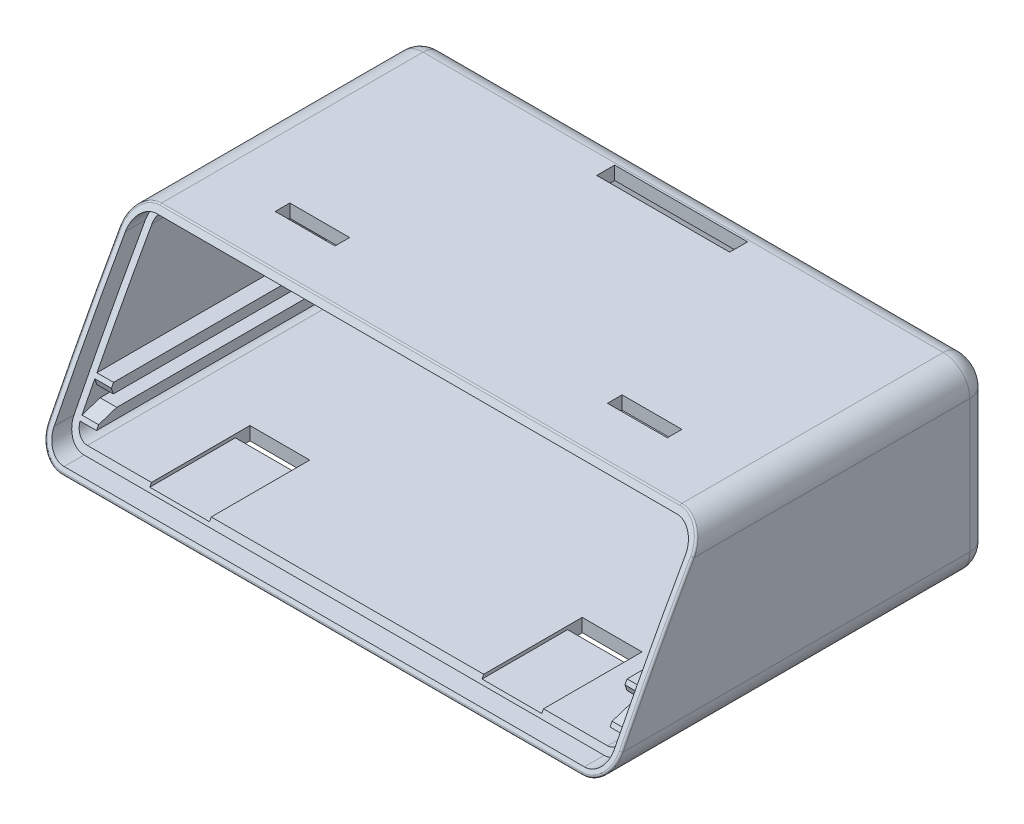
from build123d import *

# Parameters (mm, degrees)
SKETCH1_W                = 86.28
SKETCH1_H                = 57.5
BOSS_EXTRUDE1_DEPTH      = 28
FILLET1_R                = 4
SHELL1_T                 = -2
CUT_EXTRUDE1_DEPTH       = 96.156717577
SKETCH3_W                = 14.3
SKETCH3_H                = 16.7
SKETCH3_W_2              = 11.05
SKETCH3_H_2              = 14.049996967
CUT_EXTRUDE2_DEPTH       = 2
FILLET2_R                = 3
CUT_EXTRUDE3_REACH       = 157.666
CUT_EXTRUDE3_END_RADIUS  = 475
CUT_EXTRUDE3_START       = 80
FILLET3_R                = 0.3
BOSS_EXTRUDE2_REACH      = 77.532
BOSS_EXTRUDE2_END_RADIUS = 475
SKETCH5_W                = 2.5
SKETCH5_H                = 1.5
SKETCH6_W                = 9
SKETCH6_H                = 2.2
CUT_EXTRUDE4_DEPTH       = 2
SKETCH9_W                = 9
SKETCH9_H                = 2.2
CUT_EXTRUDE7_DEPTH       = 2
SKETCH7_W                = 20
SKETCH7_H                = 2.4
CUT_EXTRUDE5_DEPTH       = 2
SKETCH8_W                = 9
SKETCH8_H                = 0.5
CUT_EXTRUDE6_DEPTH       = 63.142368914
SKETCH10_W               = 9
SKETCH10_H               = 0.5
CUT_EXTRUDE8_DEPTH       = 66.69805183
SKETCH11_W               = 2.84
SKETCH11_H               = 2
SKETCH11_W_2             = 33.99
SKETCH11_W_3             = 20.1
BOSS_EXTRUDE3_DEPTH      = 0.5
CHAMFER1_SIZE2           = 2.284662113
CHAMFER1_SIZE            = 1
CHAMFER1_EDGE_2_SIZE2    = 0.742484525
CHAMFER1_EDGE_2_SIZE     = 1
CHAMFER1_EDGE_3_SIZE2    = 0.742484525
CHAMFER1_EDGE_3_SIZE     = 1
CHAMFER1_EDGE_4_SIZE2    = 2.284662113
CHAMFER1_EDGE_4_SIZE     = 1
SKETCH12_W               = 20
SKETCH12_H               = 2
CUT_EXTRUDE9_DEPTH       = 0.3


with BuildPart() as part:
    # Sketch1 → Boss-Extrude1 (new body)
    with BuildSketch(Plane(origin=(0, 0, 0), x_dir=(1, 0, 0), z_dir=(0, 1, 0))):
        Rectangle(SKETCH1_W, SKETCH1_H)
    extrude(amount=BOSS_EXTRUDE1_DEPTH)

    # Fillet1
    fillet1_edges = [part.edges().sort_by_distance(p)[0] for p in [
        (-43.14, 28, 0),
        (43.14, 28, 0),
        (-43.14, 0, 0),
        (43.14, 0, 0),
    ]]
    fillet(fillet1_edges, radius=FILLET1_R)

    # Shell1
    shell1_openings = [part.faces().sort_by_distance(p)[0] for p in [
        (0, 14, 28.75),
    ]]
    offset(amount=SHELL1_T, openings=shell1_openings, kind=Kind.INTERSECTION)

    # Sketch2 → Cut-Extrude1 (cut, through all)
    with BuildSketch(Plane.ZY.offset(43.14)):
        with BuildLine():
            Line((13.75, 28), (28.75, 28))
            Line((28.75, 28), (28.75, 0))
            ThreePointArc((28.75, 0), (21.484121584, 14.125422277), (13.75, 28))
        make_face()
    extrude(amount=-CUT_EXTRUDE1_DEPTH, mode=Mode.SUBTRACT)

    # Sketch3 → Cut-Extrude2 (cut)
    with BuildSketch(Plane(origin=(0, 0, -28.75), x_dir=(-1, 0, 0), z_dir=(0, 0, -1))):
        with Locations((0, 10.35)):
            Rectangle(SKETCH3_W, SKETCH3_H)
        with Locations((32.775, 10.175001517)):
            Rectangle(SKETCH3_W_2, SKETCH3_H_2)
    extrude(amount=-CUT_EXTRUDE2_DEPTH, mode=Mode.SUBTRACT)

    # Fillet2
    # the kernel refuses this fillet: 3 mm, written as the material it takes off along each edge
    with BuildSketch(Plane(origin=(39.14, 24, -28.75), x_dir=(1, 0, 0), z_dir=(0, -1, 0))) as fillet2_piece_1:
        with BuildLine():
            CenterArc((4 - FILLET2_R, FILLET2_R), FILLET2_R, 270, 90)
            Line((4, FILLET2_R), (4, 0))
            Line((4, 0), (4 - FILLET2_R, 0))
        make_face()
    revolve(axis=Axis((39.14, 24, -28.75), (0, 0, 1)), revolution_arc=90, mode=Mode.SUBTRACT)
    with BuildSketch(Plane(origin=(43.14, 4, -28.75), x_dir=(-1, 0, 0), z_dir=(0, 1, 0)), Plane(origin=(-43.14, 4, -28.75), x_dir=(0, 0, 1), z_dir=(0, 1, 0))) as fillet2_piece_2:
        with BuildLine():
            CenterArc((FILLET2_R, FILLET2_R), FILLET2_R, 180, 90)
            Line((0, FILLET2_R), (0, 0))
            Line((0, 0), (FILLET2_R, 0))
        make_face()
    extrude(amount=20, mode=Mode.SUBTRACT)
    with BuildSketch(Plane(origin=(39.14, 4, -28.75), x_dir=(1, 0, 0), z_dir=(0, 1, 0))) as fillet2_piece_3:
        with BuildLine():
            CenterArc((4 - FILLET2_R, -FILLET2_R), FILLET2_R, 0, 90)
            Line((4, -FILLET2_R), (4, 0))
            Line((4, 0), (4 - FILLET2_R, 0))
        make_face()
    revolve(axis=Axis((39.14, 4, -28.75), (0, 0, -1)), revolution_arc=90, mode=Mode.SUBTRACT)
    with BuildSketch(Plane(origin=(39.14, 0, -28.75), x_dir=(0, 1, 0), z_dir=(-1, 0, 0))) as fillet2_piece_4:
        with BuildLine():
            CenterArc((FILLET2_R, -FILLET2_R), FILLET2_R, 90, 90)
            Line((0, -FILLET2_R), (0, 0))
            Line((0, 0), (FILLET2_R, 0))
        make_face()
    extrude(amount=78.28, mode=Mode.SUBTRACT)
    with BuildSketch(Plane(origin=(-39.14, 4, -28.75), x_dir=(-1, 0, 0), z_dir=(0, 1, 0))) as fillet2_piece_5:
        with BuildLine():
            CenterArc((4 - FILLET2_R, FILLET2_R), FILLET2_R, 270, 90)
            Line((4 - FILLET2_R, 0), (4, 0))
            Line((4, 0), (4, FILLET2_R))
        make_face()
    revolve(axis=Axis((-39.14, 4, -28.75), (0, 0, 1)), revolution_arc=90, mode=Mode.SUBTRACT)
    with BuildSketch(Plane(origin=(-39.14, 24, -28.75), x_dir=(-1, 0, 0), z_dir=(0, -1, 0))) as fillet2_piece_6:
        with BuildLine():
            CenterArc((4 - FILLET2_R, -FILLET2_R), FILLET2_R, 0, 90)
            Line((4 - FILLET2_R, 0), (4, 0))
            Line((4, 0), (4, -FILLET2_R))
        make_face()
    revolve(axis=Axis((-39.14, 24, -28.75), (0, 0, -1)), revolution_arc=90, mode=Mode.SUBTRACT)
    with BuildSketch(Plane(origin=(39.14, 28, -28.75), x_dir=(0, -1, 0), z_dir=(-1, 0, 0))) as fillet2_piece_7:
        with BuildLine():
            CenterArc((FILLET2_R, FILLET2_R), FILLET2_R, 180, 90)
            Line((0, FILLET2_R), (0, 0))
            Line((0, 0), (FILLET2_R, 0))
        make_face()
    extrude(amount=78.28, mode=Mode.SUBTRACT)

    # Cut-Extrude3: up to this cylinder (the profile starts outside it)
    cut_extrude3_end = Plane(origin=(-23.145, -210.179748667, -400.218864179), z_dir=(-1, 0, 0)) * Cylinder(CUT_EXTRUDE3_END_RADIUS, 1266.332, mode=Mode.PRIVATE)
    # Sketch4 → Cut-Extrude3 (cut, up to the surface)
    with BuildSketch(Plane.XY.offset(-26.75).offset(CUT_EXTRUDE3_START), mode=Mode.PRIVATE) as cut_extrude3_sk1:
        with BuildLine():
            Line((-7.15, 1), (7.15, 1))
            Line((7.15, 1), (39.14, 1))
            ThreePointArc((39.14, 1), (41.261320344, 1.878679656), (42.14, 4))
            Line((42.14, 4), (42.14, 24))
            ThreePointArc((42.14, 24), (41.261320344, 26.121320344), (39.14, 27))
            Line((39.14, 27), (-39.14, 27))
            ThreePointArc((-39.14, 27), (-41.261320344, 26.121320344), (-42.14, 24))
            Line((-42.14, 24), (-42.14, 4))
            ThreePointArc((-42.14, 4), (-41.261320344, 1.878679656), (-39.14, 1))
            Line((-39.14, 1), (-7.15, 1))
        make_face()
        with BuildLine():
            Line((-7.15, 2), (7.15, 2))
            Line((7.15, 2), (39.14, 2))
            ThreePointArc((39.14, 2), (40.554213562, 2.585786438), (41.14, 4))
            Line((41.14, 4), (41.14, 24))
            ThreePointArc((41.14, 24), (40.554213562, 25.414213562), (39.14, 26))
            Line((39.14, 26), (-39.14, 26))
            ThreePointArc((-39.14, 26), (-40.554213562, 25.414213562), (-41.14, 24))
            Line((-41.14, 24), (-41.14, 4))
            ThreePointArc((-41.14, 4), (-40.554213562, 2.585786438), (-39.14, 2))
            Line((-39.14, 2), (-7.15, 2))
        make_face(mode=Mode.SUBTRACT)
    cut_extrude3_tool1 = extrude(cut_extrude3_sk1.sketch, amount=-CUT_EXTRUDE3_REACH, mode=Mode.PRIVATE) - cut_extrude3_end
    add(cut_extrude3_tool1.solids().sort_by_distance((-23.145, 1.881993, 53.25))[0], mode=Mode.SUBTRACT)

    # Fillet3
    fillet3_edges = [part.edges().sort_by_distance(p)[0] for p in [
        (0, 0, 28.75),
        (-43.14, 14.0639546, 21.517044891),
        (42.064985447, 26.728453829, 14.484309952),
        (42.046759265, 1.252137055, 28.129884144),
        (-42.046759265, 1.252137055, 28.129884144),
        (-42.064985447, 26.728453829, 14.484309952),
        (43.14, 14.0639546, 21.517044891),
        (0, 28, 13.75),
    ]]
    fillet(fillet3_edges, radius=FILLET3_R)

    # Boss-Extrude2: up to this cylinder (the profile starts inside it)
    boss_extrude2_end = Plane(origin=(0, -210.179748667, -400.218864179), z_dir=(-1, 0, 0)) * Cylinder(BOSS_EXTRUDE2_END_RADIUS, 1185.844, mode=Mode.PRIVATE)
    # Sketch5 → Boss-Extrude2 (add, up to the surface)
    with BuildSketch(Plane.XY.offset(-26.75), mode=Mode.PRIVATE) as boss_extrude2_sk1:
        with Locations((39.89, 4.5)):
            Rectangle(SKETCH5_W, SKETCH5_H)
    boss_extrude2_tool1 = extrude(boss_extrude2_sk1.sketch, amount=BOSS_EXTRUDE2_REACH, mode=Mode.PRIVATE) & boss_extrude2_end
    add(boss_extrude2_tool1.solids().sort_by_distance((39.89, 4.5, -26.75))[0])
    # Sketch5 → Boss-Extrude2 (add, up to the surface)
    with BuildSketch(Plane.XY.offset(-26.75), mode=Mode.PRIVATE) as boss_extrude2_sk2:
        with Locations((39.89, 8)):
            Rectangle(SKETCH5_W, SKETCH5_H)
    boss_extrude2_tool2 = extrude(boss_extrude2_sk2.sketch, amount=BOSS_EXTRUDE2_REACH, mode=Mode.PRIVATE) & boss_extrude2_end
    add(boss_extrude2_tool2.solids().sort_by_distance((39.89, 8, -26.75))[0])
    # Sketch5 → Boss-Extrude2 (add, up to the surface)
    with BuildSketch(Plane.XY.offset(-26.75), mode=Mode.PRIVATE) as boss_extrude2_sk3:
        with Locations((-39.89, 8)):
            Rectangle(SKETCH5_W, SKETCH5_H)
    boss_extrude2_tool3 = extrude(boss_extrude2_sk3.sketch, amount=BOSS_EXTRUDE2_REACH, mode=Mode.PRIVATE) & boss_extrude2_end
    add(boss_extrude2_tool3.solids().sort_by_distance((-39.89, 8, -26.75))[0])
    # Sketch5 → Boss-Extrude2 (add, up to the surface)
    with BuildSketch(Plane.XY.offset(-26.75), mode=Mode.PRIVATE) as boss_extrude2_sk4:
        with Locations((-39.89, 4.5)):
            Rectangle(SKETCH5_W, SKETCH5_H)
    boss_extrude2_tool4 = extrude(boss_extrude2_sk4.sketch, amount=BOSS_EXTRUDE2_REACH, mode=Mode.PRIVATE) & boss_extrude2_end
    add(boss_extrude2_tool4.solids().sort_by_distance((-39.89, 4.5, -26.75))[0])

    # Sketch6 → Cut-Extrude4 (cut)
    with BuildSketch(Plane(origin=(0, 28, 0), x_dir=(1, 0, 0), z_dir=(0, 1, 0))):
        with Locations((25, -5.03)):
            Rectangle(SKETCH6_W, SKETCH6_H)
        with Locations((-25, -5.03)):
            Rectangle(SKETCH6_W, SKETCH6_H)
    extrude(amount=-CUT_EXTRUDE4_DEPTH, mode=Mode.SUBTRACT)

    # Sketch9 → Cut-Extrude7 (cut)
    with BuildSketch(Plane.XZ):
        with Locations((-25, 11.03)):
            Rectangle(SKETCH9_W, SKETCH9_H)
        with Locations((25, 11.03)):
            Rectangle(SKETCH9_W, SKETCH9_H)
    extrude(amount=-CUT_EXTRUDE7_DEPTH, mode=Mode.SUBTRACT)

    # Sketch7 → Cut-Extrude5 (cut)
    with BuildSketch(Plane(origin=(0, 28, 0), x_dir=(1, 0, 0), z_dir=(0, 1, 0))):
        with Locations((0, 23.95)):
            Rectangle(SKETCH7_W, SKETCH7_H)
    extrude(amount=-CUT_EXTRUDE5_DEPTH, mode=Mode.SUBTRACT)

    # Sketch8 → Cut-Extrude6 (cut, through all)
    with BuildSketch(Plane(origin=(0, 0, 6.13), x_dir=(-1, 0, 0), z_dir=(0, 0, -1))):
        with Locations((-25, 26.25)):
            Rectangle(SKETCH8_W, SKETCH8_H)
        with Locations((25, 26.25)):
            Rectangle(SKETCH8_W, SKETCH8_H)
    extrude(amount=-CUT_EXTRUDE6_DEPTH, mode=Mode.SUBTRACT)

    # Sketch10 → Cut-Extrude8 (cut, through all)
    with BuildSketch(Plane(origin=(0, 0, 12.13), x_dir=(-1, 0, 0), z_dir=(0, 0, -1))):
        with Locations((25, 1.75)):
            Rectangle(SKETCH10_W, SKETCH10_H)
        with Locations((-25, 1.75)):
            Rectangle(SKETCH10_W, SKETCH10_H)
    extrude(amount=-CUT_EXTRUDE8_DEPTH, mode=Mode.SUBTRACT)

    # Sketch11 → Boss-Extrude3 (add)
    with BuildSketch(Plane.XY.offset(-26.75)):
        with Locations((-39.72, 6.25)):
            Rectangle(SKETCH11_W, SKETCH11_H)
        with Locations((24.145, 6.25)):
            Rectangle(SKETCH11_W_2, SKETCH11_H)
        with Locations((-17.2, 6.25)):
            Rectangle(SKETCH11_W_3, SKETCH11_H)
    extrude(amount=BOSS_EXTRUDE3_DEPTH)

    # Chamfer1
    chamfer1_edges = [part.edges().sort_by_distance(p)[0] for p in [
        (39.89, 5.25, 23.11908993),
    ]]
    chamfer(chamfer1_edges, length=CHAMFER1_SIZE, length2=CHAMFER1_SIZE2)

    # Chamfer1 edge 2
    chamfer1_edge_2_edges = [part.edges().sort_by_distance(p)[0] for p in [
        (39.89, 7.25, 22.095360533),
    ]]
    chamfer(chamfer1_edge_2_edges, length=CHAMFER1_EDGE_2_SIZE, length2=CHAMFER1_EDGE_2_SIZE2)

    # Chamfer1 edge 3
    chamfer1_edge_3_edges = [part.edges().sort_by_distance(p)[0] for p in [
        (-39.89, 7.25, 22.095360533),
    ]]
    chamfer(chamfer1_edge_3_edges, length=CHAMFER1_EDGE_3_SIZE, length2=CHAMFER1_EDGE_3_SIZE2)

    # Chamfer1 edge 4
    chamfer1_edge_4_edges = [part.edges().sort_by_distance(p)[0] for p in [
        (-39.89, 5.25, 23.11908993),
    ]]
    chamfer(chamfer1_edge_4_edges, length=CHAMFER1_EDGE_4_SIZE, length2=CHAMFER1_EDGE_4_SIZE2)

    # Sketch12 → Cut-Extrude9 (cut)
    with BuildSketch(Plane.XY.offset(-25.15)):
        with Locations((0, 27)):
            Rectangle(SKETCH12_W, SKETCH12_H)
    extrude(amount=-CUT_EXTRUDE9_DEPTH, mode=Mode.SUBTRACT)


solid = part.part
